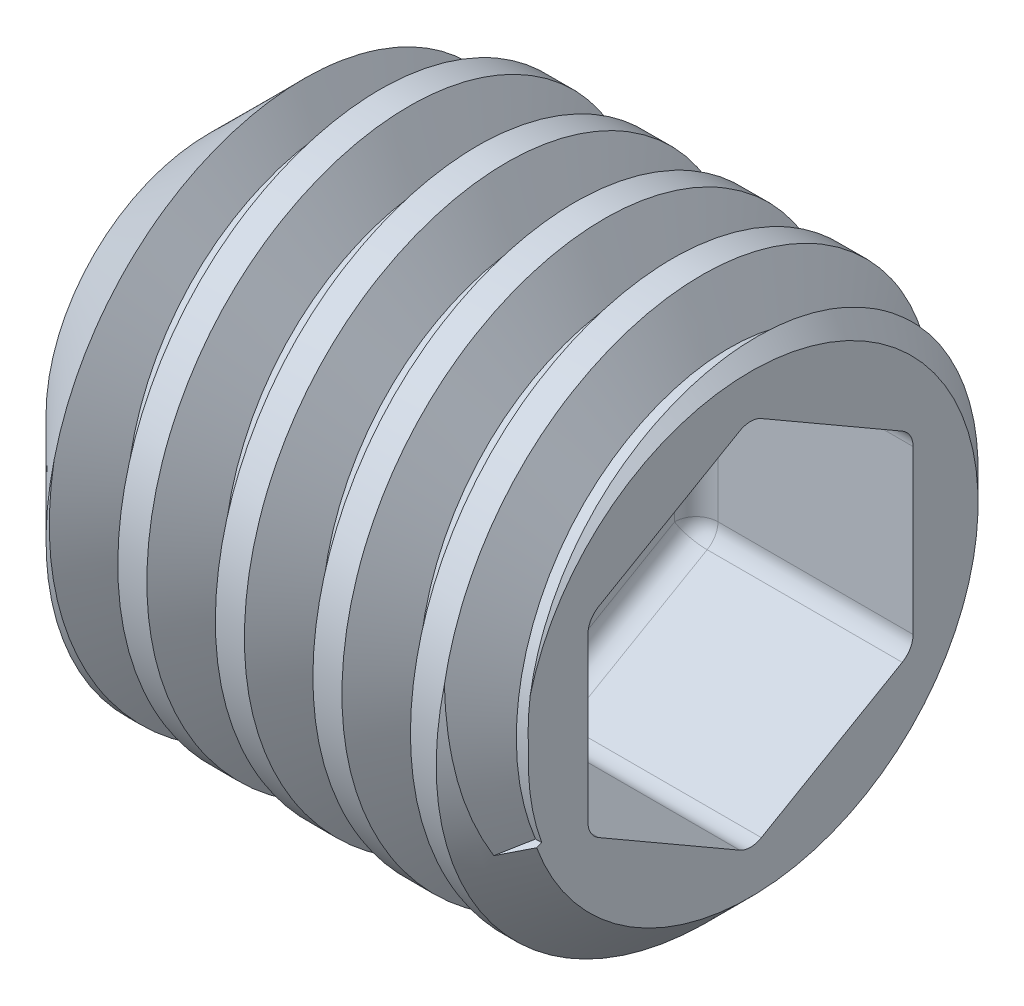
from build123d import *

# Parameters (mm, degrees)
CUT_EXTRUDE_1_DEPTH = 1
FILLET_1_R          = 0.1
SWEEP_1_PITCH       = 0.45


with BuildPart() as part:
    # Эскиз1 → Повернуть1 (revolve)
    with BuildSketch(Plane.XY, mode=Mode.PRIVATE) as revolve_1_sk:
        Polygon((0, 0), (0, 0.75), (0.5, 1.25), (2.3, 1.25), (2.5, 1.05), (2.5, 0), align=None)
    revolve(revolve_1_sk.sketch.rotate(Axis((0, 0, 0), (1, 0, 0)), 90), axis=Axis((0, 0, 0), (1, 0, 0)))

    # Эскиз2 → Вырез-Вытянуть1 (cut)
    with BuildSketch(Plane(origin=(2.5, 0, 0), x_dir=(0, 0, -1), z_dir=(1, 0, 0))):
        Polygon((0.75, 0.433012702), (0, 0.866025404), (-0.75, 0.433012702), (-0.75, -0.433012702), (0, -0.866025404), (0.75, -0.433012702), align=None)
    extrude(amount=-CUT_EXTRUDE_1_DEPTH, mode=Mode.SUBTRACT)

    # Скругление1
    fillet_1_edges = [part.edges().sort_by_distance(p)[0] for p in [
        (1.5, 0, -0.75),
        (2, 0.433012702, -0.75),
        (1.5, -0.649519053, -0.375),
        (2, -0.433012702, -0.75),
        (1.5, -0.649519053, 0.375),
        (2, -0.866025404, 0),
        (1.5, 0, 0.75),
        (2, -0.433012702, 0.75),
        (1.5, 0.649519053, 0.375),
        (2, 0.433012702, 0.75),
        (1.5, 0.649519053, -0.375),
        (2, 0.866025404, 0),
    ]]
    fillet(fillet_1_edges, radius=FILLET_1_R)

    # Вырез-По траектории1: the profile of Эскиз3 profile screwed along a right-hand helix of 5.555556 turns, 6 arcs to a turn; built about Z, then put on its axis
    sweep_1_z = Axis((0, 0, 0), (0, 0, 1))
    sweep_1_corners = [(1.025, 0, -0.028125), (1.025, 0, 0.028125), (1.2503, 0, 0.158202016), (1.2497, 0, 0.214278811), (1.358191345, 0, 0.214278811), (1.358191345, 0, -0.214278811), (1.25, 0, -0.214278811), (1.25, 0, -0.158028811)]
    with BuildLine(mode=Mode.PRIVATE) as sweep_1_profile:
        Line(sweep_1_corners[0], sweep_1_corners[1])
        Line(sweep_1_corners[1], sweep_1_corners[2])
        Line(sweep_1_corners[2], sweep_1_corners[3])
        Line(sweep_1_corners[3], sweep_1_corners[4])
        Line(sweep_1_corners[4], sweep_1_corners[5])
        Line(sweep_1_corners[5], sweep_1_corners[6])
        Line(sweep_1_corners[6], sweep_1_corners[7])
        Line(sweep_1_corners[7], sweep_1_corners[0])
    sweep_1_cap = Face(sweep_1_profile.wire())
    sweep_1_turn_angles = [0, 30, 60, 90, 120, 150, 180, 210, 240, 270, 300, 330, 360]
    sweep_1_turn_weights = [1, 0.8660254037844387, 1, 0.8660254037844387, 1, 0.8660254037844387, 1, 0.8660254037844387, 1, 0.8660254037844387, 1, 0.8660254037844387, 1]
    sweep_1_turn_rails = [Edge.make_bspline([Vector(p[0], p[1], 0).rotate(sweep_1_z, sweep_1_turn_angles[k]) / sweep_1_turn_weights[k] + Vector(0, 0, p[2] + SWEEP_1_PITCH * sweep_1_turn_angles[k] / 360) for k in range(13)], [0, 0, 0, 1, 1, 2, 2, 3, 3, 4, 4, 5, 5, 6, 6, 6], 2, sweep_1_turn_weights) for p in sweep_1_corners]
    sweep_1_turn_sides = [Face.make_surface_from_curves(sweep_1_turn_rails[p[0]], sweep_1_turn_rails[p[1]]) for p in [(0, 1), (1, 2), (2, 3), (3, 4), (4, 5), (5, 6), (6, 7), (7, 0)]]
    sweep_1_last_angles = [1800, 1830, 1860, 1890, 1920, 1950, 1980, 1990, 2000]
    sweep_1_last_weights = [1, 0.8660254037844387, 1, 0.8660254037844387, 1, 0.8660254037844387, 1, 0.9848077530122091, 1]
    sweep_1_last_rails = [Edge.make_bspline([Vector(p[0], p[1], 0).rotate(sweep_1_z, sweep_1_last_angles[k]) / sweep_1_last_weights[k] + Vector(0, 0, p[2] + SWEEP_1_PITCH * sweep_1_last_angles[k] / 360) for k in range(9)], [0, 0, 0, 1, 1, 2, 2, 3, 3, 4, 4, 4], 2, sweep_1_last_weights) for p in sweep_1_corners]
    sweep_1_last_sides = [Face.make_surface_from_curves(sweep_1_last_rails[p[0]], sweep_1_last_rails[p[1]]) for p in [(0, 1), (1, 2), (2, 3), (3, 4), (4, 5), (5, 6), (6, 7), (7, 0)]]
    sweep_1 = Plane(origin=(0, 0, 0), x_dir=(0, 0, -1), z_dir=(1, 0, 0)) * Solid(Shell([*[p.moved(Location((0, 0, SWEEP_1_PITCH * i))) for i in range(5) for p in sweep_1_turn_sides], *sweep_1_last_sides, sweep_1_cap, sweep_1_cap.rotate(sweep_1_z, 2000).moved(Location((0, 0, SWEEP_1_PITCH * 2000 / 360)))]))
    add(sweep_1, mode=Mode.SUBTRACT)


solid = part.part
